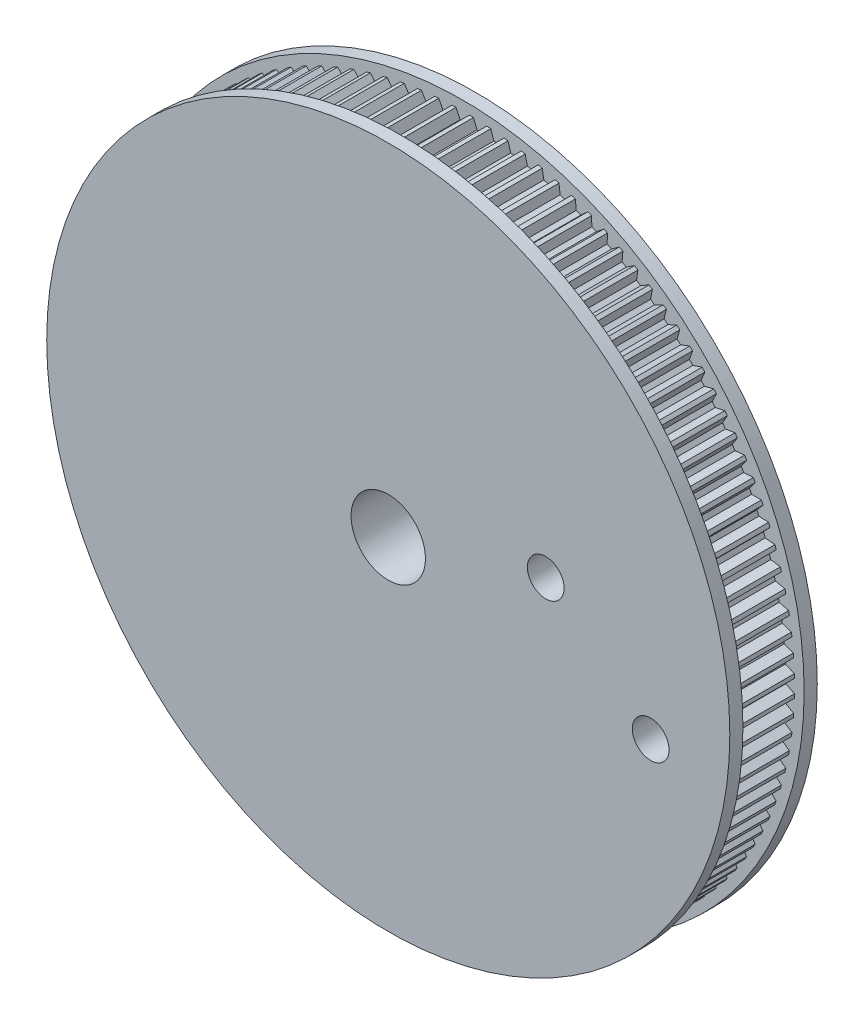
from build123d import *

# Parameters (mm, degrees)
SKETCH1_R           = 37.945
SKETCH1_R_2         = 4.25
SKETCH1_R_3         = 2.1
BOSS_EXTRUDE1_DEPTH = 10
CUT_EXTRUDE2_START  = -10
CUT_EXTRUDE2_DEPTH  = 10
CIRPATTERN2_COUNT   = 120
BOSS_EXTRUDE4_START = -10
SKETCH6_R           = 39.045
SKETCH6_R_2         = 35.945
BOSS_EXTRUDE4_DEPTH = 1.5
BOSS_EXTRUDE5_START = -1.5
SKETCH6_3_R         = 39.045
SKETCH6_3_R_2       = 35.945
BOSS_EXTRUDE5_DEPTH = 1.5


with BuildPart() as part:
    # Sketch1 → Boss-Extrude1 (new body)
    with BuildSketch(Plane.XY):
        Circle(SKETCH1_R)
        Circle(SKETCH1_R_2, mode=Mode.SUBTRACT)
        with Locations((18, 5)):
            Circle(SKETCH1_R_3, mode=Mode.SUBTRACT)
        with Locations((30, -5)):
            Circle(SKETCH1_R_3, mode=Mode.SUBTRACT)
    extrude(amount=BOSS_EXTRUDE1_DEPTH)

    # Sketch3 → Cut-Extrude2 (cut)
    with BuildSketch(Plane.XY.offset(10).offset(CUT_EXTRUDE2_START)):
        with BuildLine():
            Line((-0.28, 36.945), (0.28, 36.945))
            Line((0.28, 36.945), (0.78, 37.936982286))
            ThreePointArc((0.78, 37.936982286), (0.015003049, 37.944997034), (-0.75, 37.937587232))
            Line((-0.75, 37.937587232), (-0.28, 36.945))
        make_face()
    cut_extrude2 = extrude(amount=CUT_EXTRUDE2_DEPTH, mode=Mode.SUBTRACT)

    # CirPattern2: Cut-Extrude2 ×120 about axis
    cirpattern2_axis = Axis((0, 0, 0), (0, 0, 1))
    for i in range(1, CIRPATTERN2_COUNT):
        add(cut_extrude2.rotate(cirpattern2_axis, i * 360 / CIRPATTERN2_COUNT), mode=Mode.SUBTRACT)

    # Sketch6 → Boss-Extrude4 (add)
    with BuildSketch(Plane.XY.offset(10).offset(BOSS_EXTRUDE4_START)):
        Circle(SKETCH6_R)
        Circle(SKETCH6_R_2, mode=Mode.SUBTRACT)
    extrude(amount=BOSS_EXTRUDE4_DEPTH)

    # Sketch6<3> → Boss-Extrude5 (add)
    with BuildSketch(Plane.XY.offset(10).offset(BOSS_EXTRUDE5_START)):
        Circle(SKETCH6_3_R)
        Circle(SKETCH6_3_R_2, mode=Mode.SUBTRACT)
    extrude(amount=BOSS_EXTRUDE5_DEPTH)


solid = part.part
